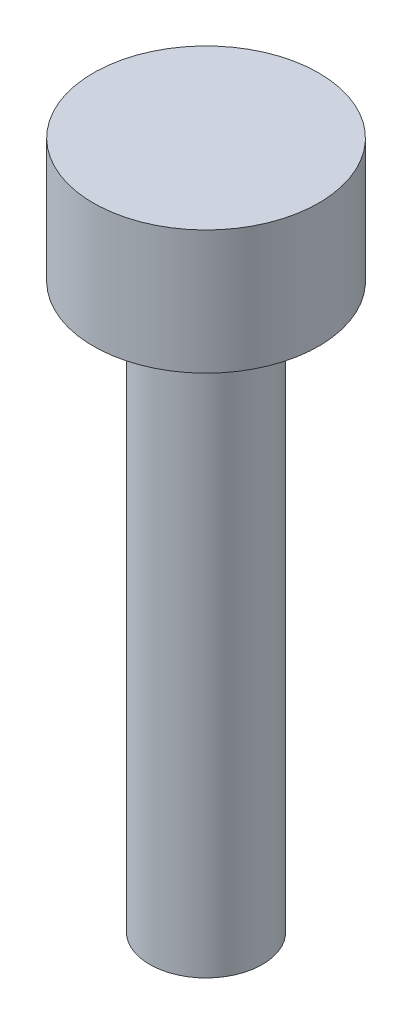
from build123d import *


with BuildPart() as part:
    # Croquis1 → Revolución1 (revolve)
    with BuildSketch(Plane.XY):
        Polygon((0, 0), (-2, 0), (-2, -2.2), (-1, -2.2), (-1, -12.2), (0, -12.2), align=None)
    revolve(axis=Axis((0, -12.2, 0), (0, 1, 0)))


solid = part.part
